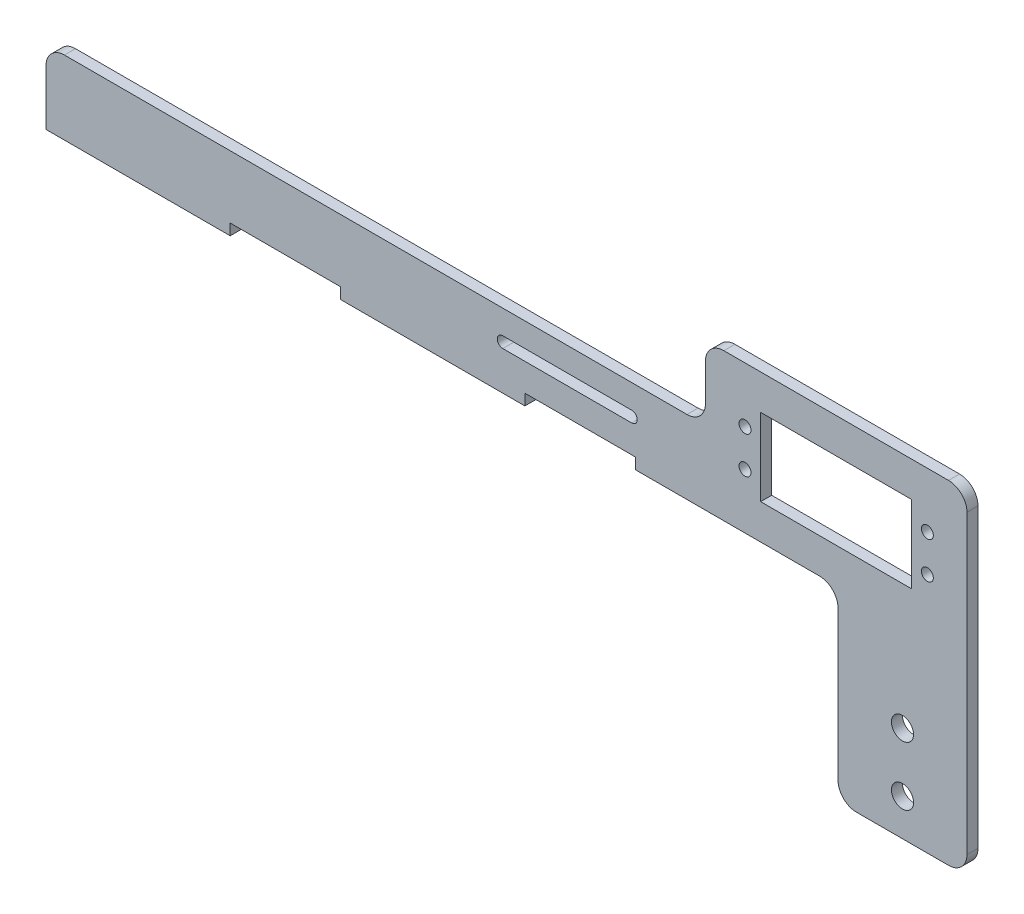
from build123d import *

# Parameters (mm, degrees)
ESBO_O1_R                = 3
ESBO_O1_R_2              = 1.625
ESBO_O1_W                = 41
ESBO_O1_H                = 21
RESSALTO_EXTRUS_O1_DEPTH = 3
FILETE1_R                = 5


with BuildPart() as part:
    # Esboço1 → Ressalto-extrusão1 (new body)
    with BuildSketch(Plane.XY):
        Polygon((160, -20), (215, -20), (215, -70.5), (250, -70.5), (250, -20), (250, 20), (179, 20), (179, 0), (0, 0), (0, -20), (50, -20), (50, -17), (80, -17), (80, -20), (130, -20), (130, -17), (160, -17), align=None)
        with Locations((232.5, -60.5)):
            Circle(ESBO_O1_R, mode=Mode.SUBTRACT)
        with Locations((232.5, -44.5)):
            Circle(ESBO_O1_R, mode=Mode.SUBTRACT)
        with BuildLine():
            ThreePointArc((124, -9.5), (122.5, -8), (124, -6.5))
            Line((124, -6.5), (159, -6.5))
            ThreePointArc((159, -6.5), (160.5, -8), (159, -9.5))
            Line((159, -9.5), (124, -9.5))
        make_face(mode=Mode.SUBTRACT)
        with Locations((189.75, -5)):
            Circle(ESBO_O1_R_2, mode=Mode.SUBTRACT)
        with Locations((239.25, -5)):
            Circle(ESBO_O1_R_2, mode=Mode.SUBTRACT)
        with Locations((214.5, 0)):
            Rectangle(ESBO_O1_W, ESBO_O1_H, mode=Mode.SUBTRACT)
        with Locations((189.75, 5)):
            Circle(ESBO_O1_R_2, mode=Mode.SUBTRACT)
        with Locations((239.25, 5)):
            Circle(ESBO_O1_R_2, mode=Mode.SUBTRACT)
    extrude(amount=RESSALTO_EXTRUS_O1_DEPTH)

    # Filete1
    filete1_edges = [part.edges().sort_by_distance(p)[0] for p in [
        (215, -20, 1.5),
        (215, -70.5, 1.5),
        (250, -70.5, 1.5),
        (250, 20, 1.5),
        (179, 20, 1.5),
        (179, 0, 1.5),
        (0, 0, 1.5),
    ]]
    fillet(filete1_edges, radius=FILETE1_R)


solid = part.part
